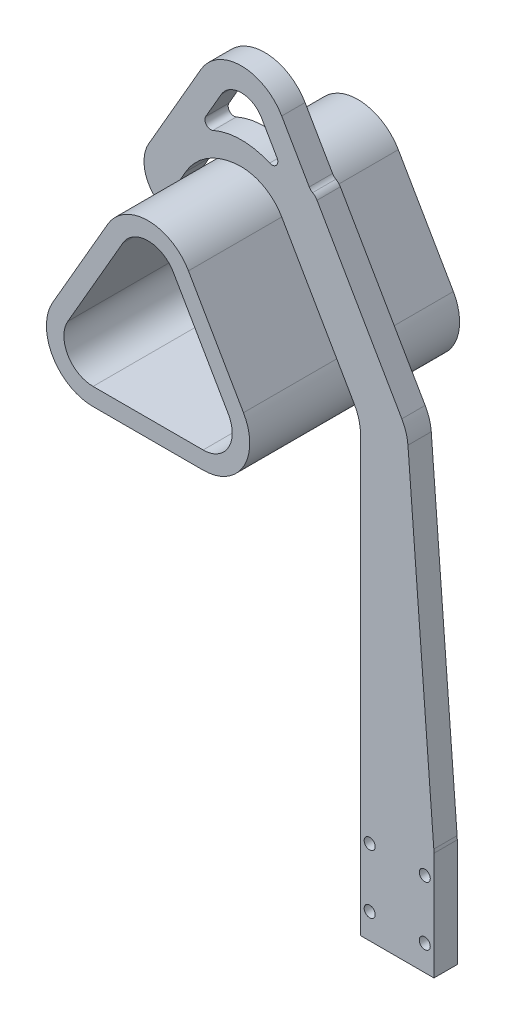
from build123d import *

# Parameters (mm, degrees)
SKETCH1_R                = 1.5
BOSS_EXTRUDE1_DEPTH      = 6.35
FILLET1_R                = 3.175
FILLET2_R                = 12.7
CUT_EXTRUDE1_REACH       = 206.848
FILLET3_R                = 1.5875
BOSS_EXTRUDE2_DEPTH      = 25.4
BOSS_EXTRUDE2_DEPTH_BACK = 31.75


with BuildPart() as part:
    # Sketch1 → Boss-Extrude1 (new body)
    with BuildSketch(Plane.XY):
        with BuildLine():
            Line((0, 0), (0, 29.9))
            Line((0, 29.9), (-7.3, 124.998217517))
            Line((-7.3, 124.998217517), (-32.380181769, 168.438366604))
            Line((-32.380181769, 168.438366604), (-32.511727314, 168.473614126))
            ThreePointArc((-32.511727314, 168.473614126), (-33.345027616, 168.884552358), (-33.957637456, 169.5831))
            Line((-33.957637456, 169.5831), (-41.45129754, 182.5625))
            ThreePointArc((-41.45129754, 182.5625), (-52.449820168, 188.9125), (-63.448342796, 182.5625))
            Line((-63.448342796, 182.5625), (-77.681242844, 157.910393978))
            ThreePointArc((-77.681242844, 157.910393978), (-78.632794368, 150.682642574), (-74.194850873, 144.899002007))
            ThreePointArc((-74.194850873, 144.899002007), (-70.94200288, 145.7706), (-71.813600873, 149.023447993))
            Line((-71.813600873, 149.023447993), (-67.572788781, 156.36875))
            ThreePointArc((-67.572788781, 156.36875), (-61.181070168, 162.760468614), (-52.449820168, 165.1))
            ThreePointArc((-52.449820168, 165.1), (-46.099820168, 163.398522628), (-41.45129754, 158.75))
            Line((-41.45129754, 158.75), (-20, 121.595262773))
            Line((-20, 121.595262773), (-20, 0))
            Line((-20, 0), (0, 0))
        make_face()
        with Locations((-2.5, 22.95)):
            Circle(SKETCH1_R, mode=Mode.SUBTRACT)
        with Locations((-2.5, 6.95)):
            Circle(SKETCH1_R, mode=Mode.SUBTRACT)
        with Locations((-17.5, 6.95)):
            Circle(SKETCH1_R, mode=Mode.SUBTRACT)
        with Locations((-17.5, 22.95)):
            Circle(SKETCH1_R, mode=Mode.SUBTRACT)
    extrude(amount=BOSS_EXTRUDE1_DEPTH)

    # Fillet1
    fillet1_edges = [part.edges().sort_by_distance(p)[0] for p in [
        (-32.380181769, 168.438366604, 3.175),
        (-71.813600873, 149.023447993, 3.175),
    ]]
    fillet(fillet1_edges, radius=FILLET1_R)

    # Fillet2
    # the kernel refuses this fillet: 12.7 mm, written as the material it adds along each edge
    with BuildSketch(Plane(origin=(-20, 121.595262773, 0), x_dir=(0, -1, 0), z_dir=(0, 0, 1))) as fillet2_piece_1:
        with BuildLine():
            CenterArc((FILLET2_R * 0.267949192431, -FILLET2_R), FILLET2_R, 90, 30)
            Line((-FILLET2_R * 0.232050807569, -FILLET2_R * 0.133974596216), (0, 0))
            Line((0, 0), (FILLET2_R * 0.267949192431, 0))
        make_face()
    extrude(amount=6.35)
    # the kernel refuses this fillet: 12.7 mm, written as the material it takes off along each edge
    with BuildSketch(Plane(origin=(-7.3, 124.998217517, -7.216461282), x_dir=(-0.5000000000000012, 0.866025403784438, 0), z_dir=(0, 0, 1))) as fillet2_2_piece_1:
        with BuildLine():
            CenterArc((FILLET2_R * 0.227290119104, FILLET2_R), FILLET2_R, 244.389572805, 25.610427195)
            Line((-FILLET2_R * 0.204959746031, FILLET2_R * 0.0982461233291), (0, 0))
            Line((0, 0), (FILLET2_R * 0.227290119104, 0))
        make_face()
    extrude(amount=20.782922563, mode=Mode.SUBTRACT)
    with BuildSketch(Plane(origin=(0, 29.9, -1.216818641), x_dir=(-0.07653757434641197, 0.9970666977254669, 0), z_dir=(0, 0, 1))) as fillet2_2_piece_2:
        with BuildLine():
            CenterArc((FILLET2_R * 0.038324996573, FILLET2_R), FILLET2_R, 265.610427195, 4.389572805)
            Line((-FILLET2_R * 0.0382125777734, FILLET2_R * 0.00293330227453), (0, 0))
            Line((0, 0), (FILLET2_R * 0.038324996573, 0))
        make_face()
    extrude(amount=8.783637282, mode=Mode.SUBTRACT)

    # Sketch2 → Cut-Extrude1 (cut, up to next)
    with BuildSketch(Plane.XY.offset(6.35), mode=Mode.PRIVATE) as cut_extrude1_sk1:
        with BuildLine():
            Line((-57.949081482, 179.3875), (-65.539358526, 166.240754516))
            ThreePointArc((-65.539358526, 166.240754516), (-52.449820168, 171.45), (-39.36028181, 166.240754516))
            Line((-39.36028181, 166.240754516), (-46.950558854, 179.3875))
            ThreePointArc((-46.950558854, 179.3875), (-52.449820168, 182.5625), (-57.949081482, 179.3875))
        make_face()
    cut_extrude1_tool1 = extrude(cut_extrude1_sk1.sketch, amount=-CUT_EXTRUDE1_REACH, mode=Mode.PRIVATE) & part.part
    add(cut_extrude1_tool1.solids().sort_by_distance((-52.44982, 175.064419, 6.35))[0], mode=Mode.SUBTRACT)

    # Fillet3
    fillet3_edges = [part.edges().sort_by_distance(p)[0] for p in [
        (-39.36028181, 166.240754516, 3.175),
        (-65.539358526, 166.240754516, 3.175),
    ]]
    fillet(fillet3_edges, radius=FILLET3_R)


with BuildPart() as body_2:
    # Sketch3 → Boss-Extrude2 (new, two sides: drawn at the far end of the back side and taken through both)
    with BuildSketch(Plane.XY.offset(6.35).offset(-BOSS_EXTRUDE2_DEPTH_BACK)):
        with BuildLine():
            Line((-41.45129754, 158.75), (-26.463977372, 132.7912))
            ThreePointArc((-26.463977372, 132.7912), (-26.463977372, 120.0912), (-37.4625, 113.7412))
            Line((-37.4625, 113.7412), (-67.437140336, 113.7412))
            ThreePointArc((-67.437140336, 113.7412), (-78.435662964, 120.0912), (-78.435662964, 132.7912))
            Line((-78.435662964, 132.7912), (-63.448342796, 158.75))
            ThreePointArc((-63.448342796, 158.75), (-52.449820168, 165.1), (-41.45129754, 158.75))
        make_face()
        with BuildLine():
            Line((-67.437140336, 118.5037), (-37.4625, 118.5037))
            ThreePointArc((-37.4625, 118.5037), (-30.588423357, 122.47245), (-30.588423357, 130.40995))
            Line((-30.588423357, 130.40995), (-45.575743525, 156.36875))
            ThreePointArc((-45.575743525, 156.36875), (-52.449820168, 160.3375), (-59.32389681, 156.36875))
            Line((-59.32389681, 156.36875), (-74.311216978, 130.40995))
            ThreePointArc((-74.311216978, 130.40995), (-74.311216978, 122.47245), (-67.437140336, 118.5037))
        make_face(mode=Mode.SUBTRACT)
    extrude(amount=BOSS_EXTRUDE2_DEPTH + BOSS_EXTRUDE2_DEPTH_BACK)


solid = Compound([part.part, body_2.part])
